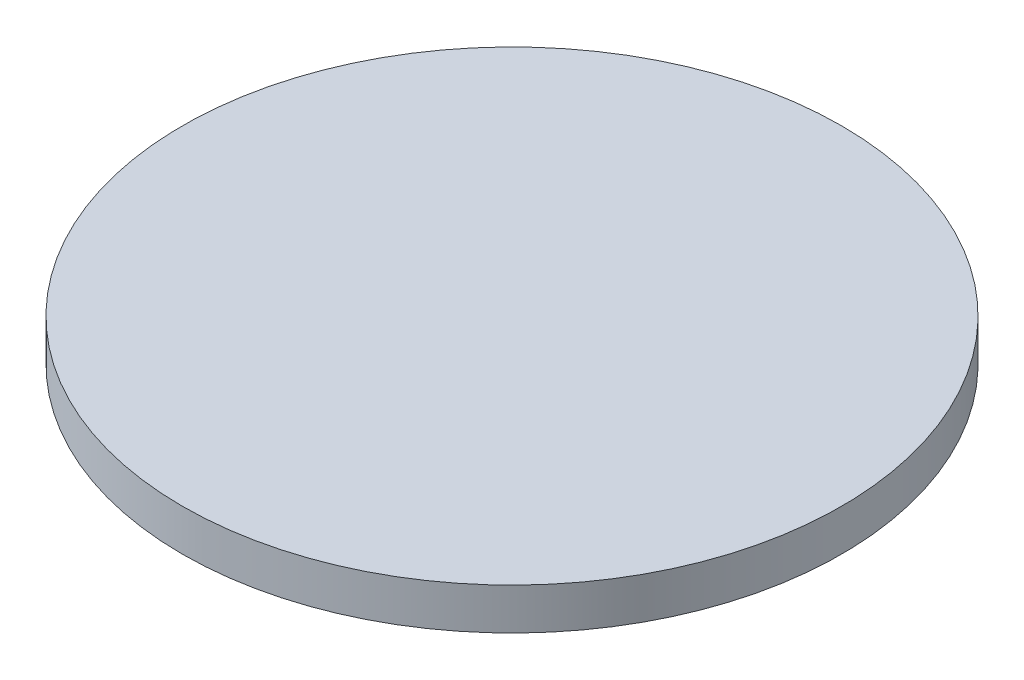
from build123d import *

# Parameters (mm, degrees)
SKETCH1_R           = 15.875
BOSS_EXTRUDE1_DEPTH = 1
BOSS_EXTRUDE3_START = 1
SKETCH6_R           = 15.875
SKETCH6_R_2         = 9.525
BOSS_EXTRUDE3_DEPTH = 1
THREAD1_PITCH       = 0.25


with BuildPart() as part:
    # Sketch1 → Boss-Extrude1 (new body)
    with BuildSketch(Plane(origin=(0, 0, 0), x_dir=(1, 0, 0), z_dir=(0, 1, 0))):
        with Locations(Location((0, 0, 0), (0, 0, 270))):
            Circle(SKETCH1_R)
    extrude(amount=BOSS_EXTRUDE1_DEPTH)

    # Sketch6 → Boss-Extrude3 (add)
    with BuildSketch(Plane.XZ.offset(BOSS_EXTRUDE3_START)):
        with Locations(Location((0, 0, 0), (0, 0, 270))):
            Circle(SKETCH6_R)
        with Locations(Location((0, 0, 0), (0, 0, 270))):
            Circle(SKETCH6_R_2, mode=Mode.SUBTRACT)
    extrude(amount=-BOSS_EXTRUDE3_DEPTH)

    # Thread1: the profile of Thread Profile1 profile screwed along a right-hand helix of 4 turns, 6 arcs to a turn; built about Z, then put on its axis
    thread1_z = Axis((0, 0, 0), (0, 0, 1))
    thread1_corners = [(9.5247, 0, -0.000173205), (9.660316469, 0, 0.078125), (9.660316469, 0, 0.109375), (9.5247, 0, 0.187673204)]
    with BuildLine(mode=Mode.PRIVATE) as thread1_profile:
        Line(thread1_corners[0], thread1_corners[1])
        Line(thread1_corners[1], thread1_corners[2])
        Line(thread1_corners[2], thread1_corners[3])
        Line(thread1_corners[3], thread1_corners[0])
    thread1_cap = Face(thread1_profile.wire())
    thread1_turn_angles = [0, 30, 60, 90, 120, 150, 180, 210, 240, 270, 300, 330, 360]
    thread1_turn_weights = [1, 0.8660254037844387, 1, 0.8660254037844387, 1, 0.8660254037844387, 1, 0.8660254037844387, 1, 0.8660254037844387, 1, 0.8660254037844387, 1]
    thread1_turn_rails = [Edge.make_bspline([Vector(p[0], p[1], 0).rotate(thread1_z, thread1_turn_angles[k]) / thread1_turn_weights[k] + Vector(0, 0, p[2] + THREAD1_PITCH * thread1_turn_angles[k] / 360) for k in range(13)], [0, 0, 0, 1, 1, 2, 2, 3, 3, 4, 4, 5, 5, 6, 6, 6], 2, thread1_turn_weights) for p in thread1_corners]
    thread1_turn_sides = [Face.make_surface_from_curves(thread1_turn_rails[p[0]], thread1_turn_rails[p[1]]) for p in [(0, 1), (1, 2), (2, 3), (3, 0)]]
    thread1 = Plane(origin=(0, -1, 0), x_dir=(1, 0, 0), z_dir=(0, 1, 0)) * Solid(Shell([*[p.moved(Location((0, 0, THREAD1_PITCH * i))) for i in range(4) for p in thread1_turn_sides], thread1_cap, thread1_cap.rotate(thread1_z, 1440).moved(Location((0, 0, THREAD1_PITCH * 1440 / 360)))]))
    add(thread1, mode=Mode.SUBTRACT)


solid = part.part
